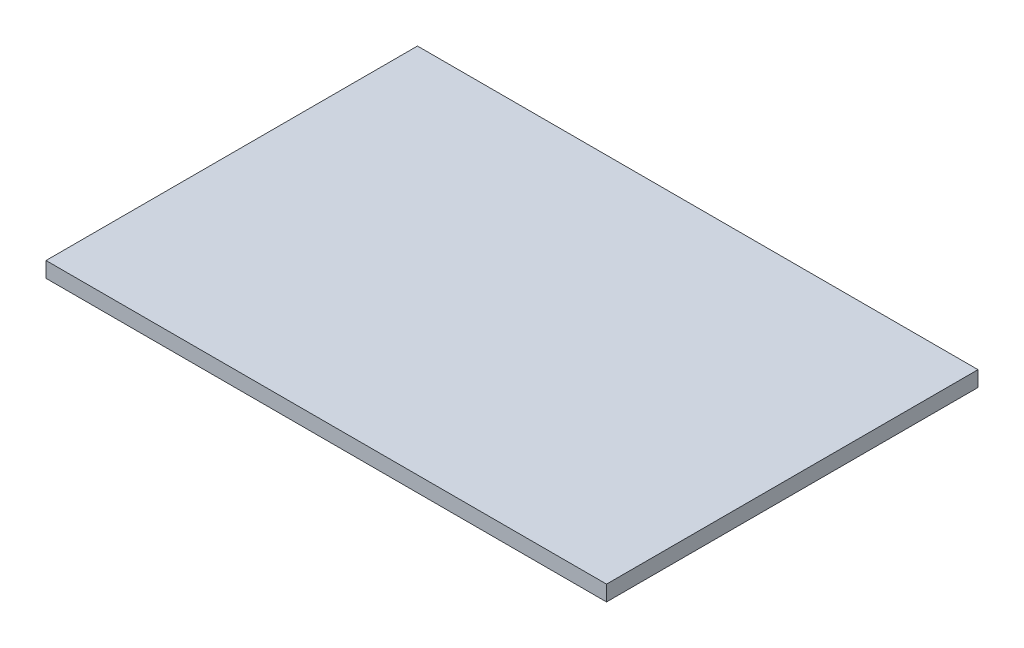
from build123d import *

# Parameters (mm, degrees)
SKETCH1_W           = 229.969358589
SKETCH1_H           = 6.35
BOSS_EXTRUDE1_DEPTH = 152.4


with BuildPart() as part:
    # Sketch1 → Boss-Extrude1 (new body)
    with BuildSketch(Plane.XY):
        with Locations((-24.365205383, 152.4)):
            Rectangle(SKETCH1_W, SKETCH1_H)
    extrude(amount=BOSS_EXTRUDE1_DEPTH)


solid = part.part
